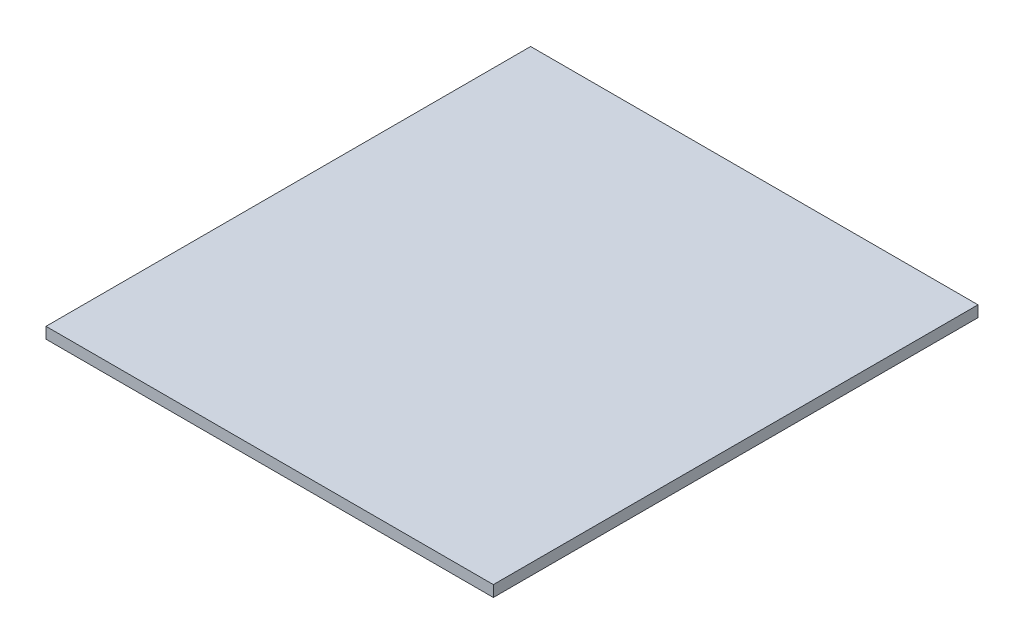
from build123d import *

# Parameters (mm, degrees)
SKETCH1_W               = 60
SKETCH1_H               = 65
SKETCH1_W_2             = 55
SKETCH1_H_2             = 60
BOSS_EXTRUDE1_DEPTH     = 40
SKETCH2_W               = 60
SKETCH2_H               = 65
BOSS_EXTRUDE2_DEPTH     = 2.5
BOSS_EXTRUDE3_DEPTH     = 65
CUT_EXTRUDE1_REACH      = 83.03
CUT_EXTRUDE2_DEPTH      = 84.873058845
CUT_EXTRUDE2_DEPTH_BACK = 84.873058845
SKETCH5_W               = 60
SKETCH5_H               = 41
SNAP_START              = -17.466738465
SNAP_HOOK1_DEPTH        = 0.923076923
SNAP_START_2            = -1.762465991
SNAP_HOOK1_2_DEPTH      = 3.524931982
SNAP_START_3            = -1.989936516
SNAP_HOOK1_3_DEPTH      = 3.979873032
SNAP_START_4            = -19
SNAP_HOOK1_4_DEPTH      = 5
CUT_EXTRUDE3_DEPTH      = 73.867619695
CUT_EXTRUDE3_DEPTH_BACK = 73.867619695
SKETCH6_W               = 60.42921797
SKETCH6_H               = 2.598338556


with BuildPart() as part:
    # Sketch1 → Boss-Extrude1 (new body)
    with BuildSketch(Plane(origin=(0, 0, 0), x_dir=(1, 0, 0), z_dir=(0, 1, 0))):
        Rectangle(SKETCH1_W, SKETCH1_H)
        Rectangle(SKETCH1_W_2, SKETCH1_H_2, mode=Mode.SUBTRACT)
    extrude(amount=BOSS_EXTRUDE1_DEPTH)

    # Sketch2 → Boss-Extrude2 (add)
    with BuildSketch(Plane(origin=(0, 40, 0), x_dir=(1, 0, 0), z_dir=(0, 1, 0))):
        Rectangle(SKETCH2_W, SKETCH2_H)
    extrude(amount=BOSS_EXTRUDE2_DEPTH)

    # Sketch3 → Boss-Extrude3 (add)
    with BuildSketch(Plane(origin=(0, 0, -32.5), x_dir=(-1, 0, 0), z_dir=(0, 0, -1))):
        Polygon((-30, 42.5), (-28.8, 43.7), (-27.6, 42.5), (-26.4, 43.7), (-25.2, 42.5), (-24, 43.7), (-22.8, 42.5), (-21.6, 43.7), (-20.4, 42.5), (-19.2, 43.7), (-18, 42.5), (-16.8, 43.7), (-15.6, 42.5), (-14.4, 43.7), (-13.2, 42.5), (-12, 43.7), (-10.8, 42.5), (-9.6, 43.7), (-8.4, 42.5), (-7.2, 43.7), (-6, 42.5), (-4.8, 43.7), (-3.6, 42.5), (-2.4, 43.7), (-1.2, 42.5), (0, 43.7), (1.2, 42.5), (2.4, 43.7), (3.6, 42.5), (4.8, 43.7), (6, 42.5), (7.2, 43.7), (8.4, 42.5), (9.6, 43.7), (10.8, 42.5), (12, 43.7), (13.2, 42.5), (14.4, 43.7), (15.6, 42.5), (16.8, 43.7), (18, 42.5), (19.2, 43.7), (20.4, 42.5), (21.6, 43.7), (22.8, 42.5), (24, 43.7), (25.2, 42.5), (26.4, 43.7), (27.6, 42.5), (28.8, 43.7), (30, 42.5), (30, 42.170064374), (-30, 42.170064374), align=None)
    extrude(amount=-BOSS_EXTRUDE3_DEPTH)

    # Cut-Extrude1: up to this face of the body (flat: up to its plane)
    cut_extrude1_end = Plane(part.part.faces().sort_by_distance((30, 21.25, 0))[0])
    # Sketch4 → Cut-Extrude1 (cut, up to the picked face)
    with BuildSketch(Plane.ZY.offset(30), mode=Mode.PRIVATE) as cut_extrude1_sk1:
        with BuildLine():
            Line((-32.5, 42.5), (-32.5, 43.7))
            Line((-32.5, 43.7), (-31.3, 43.7))
            ThreePointArc((-31.3, 43.7), (-32.148528137, 43.348528137), (-32.5, 42.5))
        make_face()
    cut_extrude1_tool1 = split(extrude(cut_extrude1_sk1.sketch, amount=-CUT_EXTRUDE1_REACH, mode=Mode.PRIVATE), bisect_by=cut_extrude1_end, keep=Keep.BOTH, mode=Mode.PRIVATE)
    cut_extrude1 = cut_extrude1_tool1.solids().sort_by(Axis((-30, 43.431958, -32.231958), (1, 0, 0)))[0]
    add(cut_extrude1, mode=Mode.SUBTRACT)

    # Mirror1: Cut-Extrude1 across plane
    add(cut_extrude1.mirror(Plane.XY), mode=Mode.SUBTRACT)

    # Sketch5 → Cut-Extrude2 (cut, two sides: drawn at the far end of the back side and taken through both)
    with BuildSketch(Plane.XY.offset(32.5).offset(-CUT_EXTRUDE2_DEPTH_BACK)):
        with Locations((0, 20.5)):
            Rectangle(SKETCH5_W, SKETCH5_H)
    extrude(amount=CUT_EXTRUDE2_DEPTH + CUT_EXTRUDE2_DEPTH_BACK, mode=Mode.SUBTRACT)

    # Snap Hook1: read off the stored shape, not the designer's step
    # Snap Hook1 outline → Snap Hook1 (add)
    with BuildSketch(Plane.XY.offset(SNAP_START)):
        Polygon((-1.5, 35.4), (1.5, 35.4), (1.989936516, 41), (-1.989936516, 41), align=None)
    snap_hook1 = extrude(amount=SNAP_HOOK1_DEPTH)

    # Snap Hook1 2 outline → Snap Hook1 2 (add)
    with BuildSketch(Plane.YZ.offset(SNAP_START_2)):
        Polygon((38.4, -17.466738465), (35.4, -17.466738465), (37.9, -18.466738465), (38.4, -18.466738465), align=None)
        Polygon((35.4, -16.543661542), (41, -16.543661542), (41, -15.466738465), align=None)
    snap_hook1_2 = extrude(amount=SNAP_HOOK1_2_DEPTH)

    # Snap Hook1 3 outline → Snap Hook1 3 (add)
    with BuildSketch(Plane.YZ.offset(SNAP_START_3)):
        Polygon((35.4, -16.543661542), (41, -16.543661542), (41, -15.466738465), align=None)
    snap_hook1_3 = extrude(amount=SNAP_HOOK1_3_DEPTH)

    # Snap Hook1 4 outline → Snap Hook1 4 (cut)
    with BuildSketch(Plane.XY.offset(SNAP_START_4)):
        Polygon((-1.989936516, 41), (-1.989936516, 34), (-1.377515871, 34), align=None)
        Polygon((1.377515871, 34), (1.989936516, 34), (1.989936516, 41), align=None)
    snap_hook1_4 = extrude(amount=SNAP_HOOK1_4_DEPTH, mode=Mode.SUBTRACT)

    # Mirror2: Snap Hook1, Snap Hook1 2, Snap Hook1 3, Snap Hook1 4 across plane
    add(snap_hook1.mirror(Plane.XY))
    add(snap_hook1_2.mirror(Plane.XY))
    add(snap_hook1_3.mirror(Plane.XY))
    add(snap_hook1_4.mirror(Plane.XY), mode=Mode.SUBTRACT)

    # Sketch6 → Cut-Extrude3 (cut, two sides: drawn at the far end of the back side and taken through both)
    with BuildSketch(Plane(origin=(0, 0, -17.5), x_dir=(-1, 0, 0), z_dir=(0, 0, -1)).offset(-CUT_EXTRUDE3_DEPTH_BACK)):
        with Locations((0.214608985, 43.799169278)):
            Rectangle(SKETCH6_W, SKETCH6_H)
    extrude(amount=CUT_EXTRUDE3_DEPTH + CUT_EXTRUDE3_DEPTH_BACK, mode=Mode.SUBTRACT)


solid = part.part
